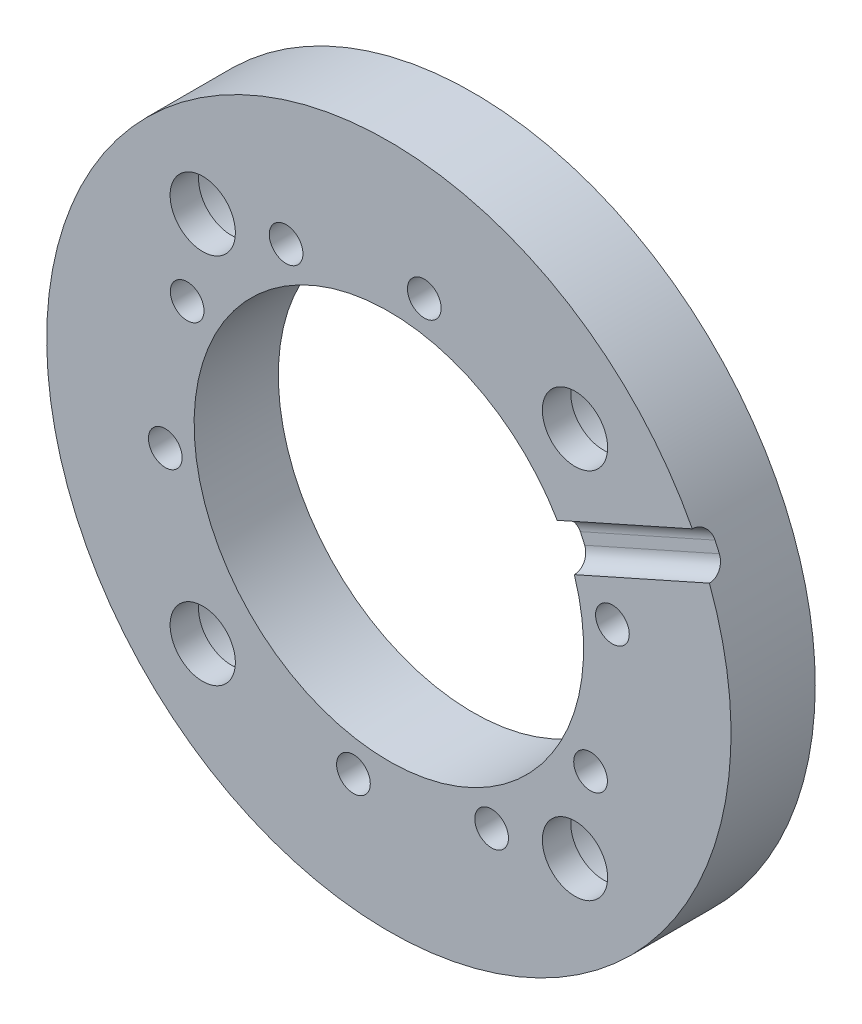
from build123d import *

# Parameters (mm, degrees)
SKETCH1_R           = 32.5
SKETCH1_R_2         = 3.1
SKETCH1_R_3         = 18.5
BOSS_EXTRUDE2_DEPTH = 8
SKETCH1_6_R         = 18.5
SKETCH1_6_R_2       = 5.55
SKETCH1_6_R_3       = 3.1
CUT_EXTRUDE2_DEPTH  = 5.3
SKETCH2_R           = 1.6
CUT_EXTRUDE3_DEPTH  = 10
CUT_EXTRUDE4_DEPTH  = 1.5
FILLET1_R           = 1.5


with BuildPart() as part:
    # Sketch1 → Boss-Extrude2 (new body)
    with BuildSketch(Plane.XY):
        Circle(SKETCH1_R)
        with Locations((17.67766953, 17.67766953)):
            Circle(SKETCH1_R_2, mode=Mode.SUBTRACT)
        with Locations((17.67766953, -17.67766953)):
            Circle(SKETCH1_R_2, mode=Mode.SUBTRACT)
        with Locations((-17.67766953, -17.67766953)):
            Circle(SKETCH1_R_2, mode=Mode.SUBTRACT)
        with Locations((-17.67766953, 17.67766953)):
            Circle(SKETCH1_R_2, mode=Mode.SUBTRACT)
        Circle(SKETCH1_R_3, mode=Mode.SUBTRACT)
    extrude(amount=BOSS_EXTRUDE2_DEPTH)

    # Sketch1<6> → Cut-Extrude2 (cut)
    # profile 1 of 8: a face of its own
    with BuildSketch(Plane.XY):
        Circle(SKETCH1_6_R)
    # profile 2 of 8: a face of its own
    with BuildSketch(Plane.XY):
        with Locations((17.67766953, 17.67766953)):
            Circle(SKETCH1_6_R_2)
        with Locations((17.67766953, 17.67766953)):
            Circle(SKETCH1_6_R_3, mode=Mode.SUBTRACT)
    # profile 3 of 8: a face of its own
    with BuildSketch(Plane.XY):
        Circle(SKETCH1_6_R)
    # profile 4 of 8: a face of its own
    with BuildSketch(Plane.XY):
        with Locations((17.67766953, -17.67766953)):
            Circle(SKETCH1_6_R_2)
        with Locations((17.67766953, -17.67766953)):
            Circle(SKETCH1_6_R_3, mode=Mode.SUBTRACT)
    # profile 5 of 8: a face of its own
    with BuildSketch(Plane.XY):
        Circle(SKETCH1_6_R)
    # profile 6 of 8: a face of its own
    with BuildSketch(Plane.XY):
        with Locations((-17.67766953, -17.67766953)):
            Circle(SKETCH1_6_R_2)
        with Locations((-17.67766953, -17.67766953)):
            Circle(SKETCH1_6_R_3, mode=Mode.SUBTRACT)
    # profile 7 of 8: a face of its own
    with BuildSketch(Plane.XY):
        Circle(SKETCH1_6_R)
    # profile 8 of 8: a face of its own
    with BuildSketch(Plane.XY):
        with Locations((-17.67766953, 17.67766953)):
            Circle(SKETCH1_6_R_2)
        with Locations((-17.67766953, 17.67766953)):
            Circle(SKETCH1_6_R_3, mode=Mode.SUBTRACT)
    extrude(amount=CUT_EXTRUDE2_DEPTH, mode=Mode.SUBTRACT)

    # Sketch2 → Cut-Extrude3 (cut)
    with BuildSketch(Plane(origin=(0, 0, 0), x_dir=(-1, 0, 0), z_dir=(0, 0, -1))):
        with Locations((9.760795744, 19.15664027)):
            Circle(SKETCH2_R)
        with Locations((19.15664027, 9.760795744)):
            Circle(SKETCH2_R)
        with Locations((21.235299323, -3.363340998)):
            Circle(SKETCH2_R)
        with Locations((3.363340998, -21.235299323)):
            Circle(SKETCH2_R)
        with Locations((-9.760795744, -19.15664027)):
            Circle(SKETCH2_R)
        with Locations((-19.15664027, -9.760795744)):
            Circle(SKETCH2_R)
        with Locations((-21.235299323, 3.363340998)):
            Circle(SKETCH2_R)
        with Locations((-3.363340998, 21.235299323)):
            Circle(SKETCH2_R)
    extrude(amount=-CUT_EXTRUDE3_DEPTH, mode=Mode.SUBTRACT)

    # Sketch4 → Cut-Extrude4 (cut)
    with BuildSketch(Plane.XY.offset(8)):
        Polygon((14.516655151, 4.273958731), (32.787564304, 12.408691592), (31.160617731, 16.062873423), (12.889708578, 7.928140561), align=None)
    extrude(amount=-CUT_EXTRUDE4_DEPTH, mode=Mode.SUBTRACT)

    # Fillet1
    fillet1_edges = [part.edges().sort_by_distance(p)[0] for p in [
        (22.404274162, 12.164298088, 6.5),
        (24.031220735, 8.510116257, 6.5),
    ]]
    fillet(fillet1_edges, radius=FILLET1_R - 0.0001)  # a hair under: the kernel refuses the full size


solid = part.part
